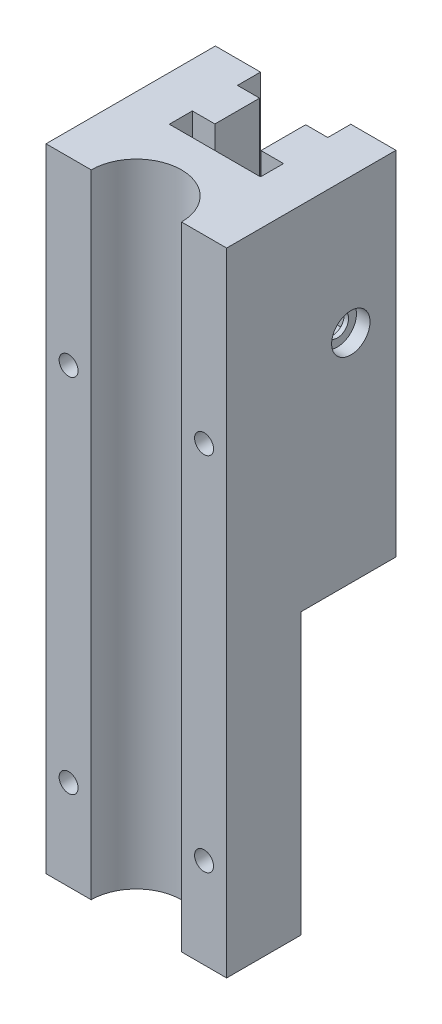
from build123d import *

# Parameters (mm, degrees)
BOSS_EXTRUDE1_DEPTH     = 140
SKETCH5_W               = 40
SKETCH5_H               = 21
CUT_EXTRUDE5_DEPTH      = 62
CUT_EXTRUDE2_DEPTH      = 1
CUT_EXTRUDE2_DEPTH_BACK = 30
CUT_EXTRUDE2_START      = -5
SKETCH3_W               = 10
SKETCH3_H               = 10
SKETCH3_3_R             = 2.5
CUT_EXTRUDE3_DEPTH      = 151.353749538
SKETCH3_5_R             = 4.25
SKETCH3_5_R_2           = 2.5
CUT_EXTRUDE4_DEPTH      = 3
SKETCH7_R               = 2.1
CUT_EXTRUDE7_DEPTH      = 10


with BuildPart() as part:
    # Sketch1 → Boss-Extrude1 (new body)
    with BuildSketch(Plane(origin=(0, 0, 0), x_dir=(1, 0, 0), z_dir=(0, 1, 0))):
        with BuildLine():
            Line((-10, -5.1), (-10, 0))
            Line((-10, 0), (-20, 0))
            Line((-20, 0), (-20, -37.5))
            Line((-20, -37.5), (-10, -37.5))
            ThreePointArc((-10, -37.5), (0, -27.5), (10, -37.5))
            Line((10, -37.5), (20, -37.5))
            Line((20, -37.5), (20, 0))
            Line((20, 0), (10, 0))
            Line((10, 0), (10, -5.1))
            Line((10, -5.1), (5.1, -5.1))
            Line((5.1, -5.1), (5.1, -15))
            Line((5.1, -15), (10.1, -15))
            Line((10.1, -15), (10.1, -20.1))
            Line((10.1, -20.1), (-10.1, -20.1))
            Line((-10.1, -20.1), (-10.1, -15))
            Line((-10.1, -15), (-5.1, -15))
            Line((-5.1, -15), (-5.1, -5.1))
            Line((-5.1, -5.1), (-10, -5.1))
        make_face()
    extrude(amount=-BOSS_EXTRUDE1_DEPTH)

    # Sketch5 → Cut-Extrude5 (cut)
    with BuildSketch(Plane.XZ.offset(140)):
        with Locations((0, 10.5)):
            Rectangle(SKETCH5_W, SKETCH5_H)
    extrude(amount=-CUT_EXTRUDE5_DEPTH, mode=Mode.SUBTRACT)

    # Sketch3 → Cut-Extrude2 (cut, two sides: drawn at the far end of the back side and taken through both)
    with BuildSketch(Plane(origin=(20, 0, 0), x_dir=(0, 0, -1), z_dir=(1, 0, 0)).offset(CUT_EXTRUDE2_START - CUT_EXTRUDE2_DEPTH_BACK)):
        with Locations((-10, -30)):
            Rectangle(SKETCH3_W, SKETCH3_H)
    extrude(amount=CUT_EXTRUDE2_DEPTH + CUT_EXTRUDE2_DEPTH_BACK, mode=Mode.SUBTRACT)

    # Sketch3<3> → Cut-Extrude3 (cut, through all)
    with BuildSketch(Plane(origin=(20, 0, 0), x_dir=(0, 0, -1), z_dir=(1, 0, 0))):
        with Locations((-10, -30)):
            Circle(SKETCH3_3_R)
    extrude(amount=-CUT_EXTRUDE3_DEPTH, mode=Mode.SUBTRACT)

    # Sketch3<5> → Cut-Extrude4 (cut)
    with BuildSketch(Plane(origin=(20, 0, 0), x_dir=(0, 0, -1), z_dir=(1, 0, 0))):
        with Locations((-10, -30)):
            Circle(SKETCH3_5_R)
        with Locations((-10, -30)):
            Circle(SKETCH3_5_R_2, mode=Mode.SUBTRACT)
    cut_extrude4 = extrude(amount=-CUT_EXTRUDE4_DEPTH, mode=Mode.SUBTRACT)

    # Mirror1: Cut-Extrude4 across plane
    add(cut_extrude4.mirror(Plane(origin=(0, 0, 0), x_dir=(0, 0, 1), z_dir=(1, 0, 0))), mode=Mode.SUBTRACT)

    # Sketch7 → Cut-Extrude7 (cut)
    with BuildSketch(Plane.XY.offset(37.5)):
        with Locations((-15, -120)):
            Circle(SKETCH7_R)
        with Locations((15, -120)):
            Circle(SKETCH7_R)
        with Locations((-15, -40)):
            Circle(SKETCH7_R)
        with Locations((15, -40)):
            Circle(SKETCH7_R)
    extrude(amount=-CUT_EXTRUDE7_DEPTH, mode=Mode.SUBTRACT)


solid = part.part
